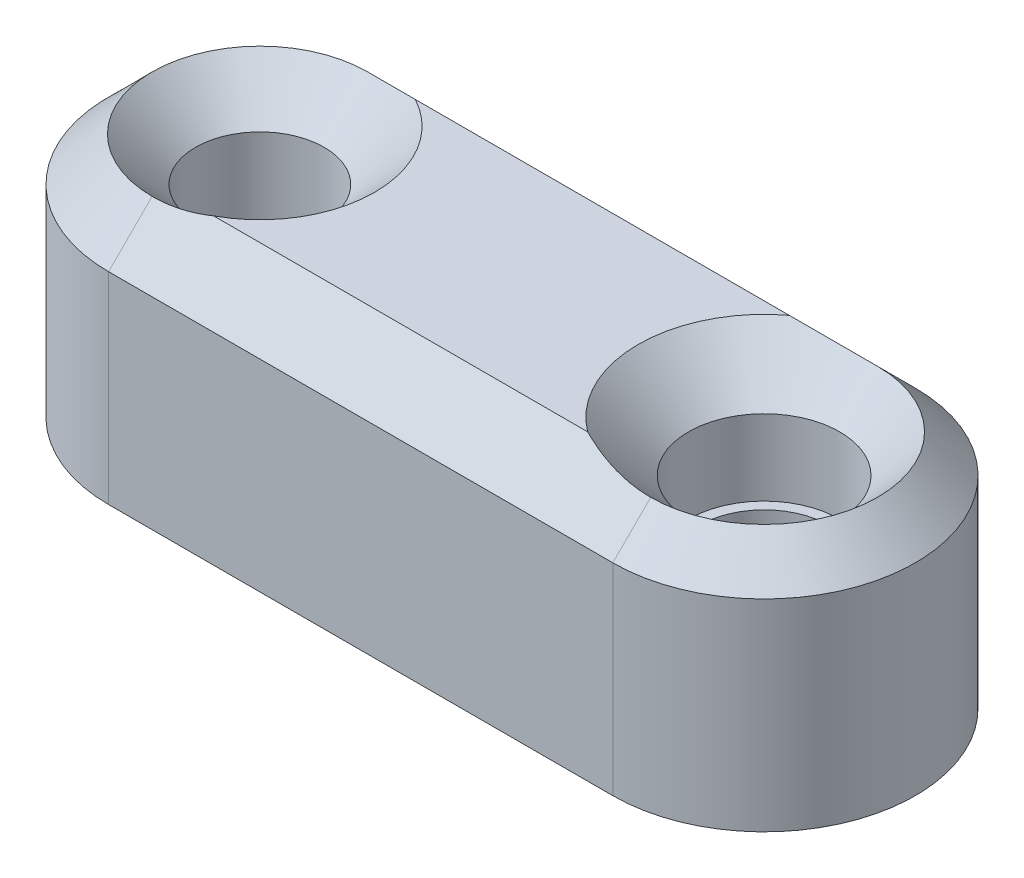
from build123d import *

# Parameters (mm, degrees)
EXTRUDE_1_DEPTH     = 10
CHAMFER_1_SIZE      = 2
CUT_EXTRUDE_1_DEPTH = 5


with BuildPart() as part:
    # 草图1 → 凸台-拉伸1 (new body)
    with BuildSketch(Plane(origin=(0, 0, 0), x_dir=(1, 0, 0), z_dir=(0, 1, 0))):
        with BuildLine():
            Line((0, 6), (20, 6))
            ThreePointArc((20, 6), (26, 0), (20, -6))
            Line((20, -6), (0, -6))
            ThreePointArc((0, -6), (-6, 0), (0, 6))
        make_face()
    extrude(amount=EXTRUDE_1_DEPTH)

    # 草图2 → 切除-旋转1 (revolve, cut)
    with BuildSketch(Plane.XY, mode=Mode.PRIVATE) as cut_revolve_1_sk:
        Polygon((-2.55, 10), (-2.55, 5), (-1.6, 5), (-1.6, 2), (-2.55, 2), (-2.55, 0), (0, 0), (0, 10), align=None)
    revolve(cut_revolve_1_sk.sketch.rotate(Axis((0, 0, 0), (0, 1, 0)), 270), axis=Axis((0, 0, 0), (0, 1, 0)), mode=Mode.SUBTRACT)

    # 草图3 → 切除-旋转2 (revolve, cut)
    with BuildSketch(Plane.XY, mode=Mode.PRIVATE) as cut_revolve_2_sk:
        Polygon((20, 0), (17.425, 0), (17.425, 5), (17, 5), (17, 10), (20, 10), align=None)
    revolve(cut_revolve_2_sk.sketch.rotate(Axis((20, 10, 0), (0, -1, 0)), 270), axis=Axis((20, 10, 0), (0, -1, 0)), mode=Mode.SUBTRACT)

    # 倒角1
    # the kernel refuses this chamfer: 2 mm, written as the material it takes off along each edge
    with BuildSketch(Plane(origin=(20, 10, 0), x_dir=(0, 0, -1), z_dir=(-1, 0, 0))) as chamfer_1_piece_1:
        Polygon((6, CHAMFER_1_SIZE), (6 - CHAMFER_1_SIZE, 0), (6, 0), align=None)
    revolve(axis=Axis((20, 10, 0), (0, -1, 0)), revolution_arc=180, mode=Mode.SUBTRACT)
    with BuildSketch(Plane(origin=(0, 10, 0), x_dir=(0, 0, -1), z_dir=(1, 0, 0))) as chamfer_1_piece_2:
        Polygon((2.55 + CHAMFER_1_SIZE, 0), (2.55, -CHAMFER_1_SIZE), (2.55, 0), align=None)
    revolve(axis=Axis((0, 10, 0), (0, 1, 0)), mode=Mode.SUBTRACT)
    with BuildSketch(Plane(origin=(0, 10, -6), x_dir=(0, -0.9996219169112968, -0.027495876610586487), z_dir=(1, 0, 0)), Plane(origin=(20, 10, 6), x_dir=(0, -0.9996219169112968, 0.027495876610586487), z_dir=(-1, 0, 0))) as chamfer_1_piece_3:
        Polygon((CHAMFER_1_SIZE * 0.999621916911, -CHAMFER_1_SIZE * 0.0274958766106), (-CHAMFER_1_SIZE * 0.0274958766106, -CHAMFER_1_SIZE * 0.999621916911), (0, 0), align=None)
    extrude(amount=20, mode=Mode.SUBTRACT)
    with BuildSketch(Plane(origin=(20, 10, 0), x_dir=(0, 0, 1), z_dir=(1, 0, 0))) as chamfer_1_piece_4:
        Polygon((3 + CHAMFER_1_SIZE, 0), (3, CHAMFER_1_SIZE), (3, 0), align=None)
    revolve(axis=Axis((20, 10, 0), (0, -1, 0)), mode=Mode.SUBTRACT)
    with BuildSketch(Plane(origin=(0, 10, 0), x_dir=(0, 0, 1), z_dir=(1, 0, 0))) as chamfer_1_piece_5:
        Polygon((6 - CHAMFER_1_SIZE, 0), (6, CHAMFER_1_SIZE), (6, 0), align=None)
    revolve(axis=Axis((0, 10, 0), (0, -1, 0)), revolution_arc=180, mode=Mode.SUBTRACT)

    # 草图4 → 切除-拉伸1 (cut)
    with BuildSketch(Plane.XZ):
        Polygon((-2.107328483, -3.65), (2.107328483, -3.65), (4.214656965, 0), (2.107328483, 3.65), (-2.107328483, 3.65), (-4.214656965, 0), align=None)
    extrude(amount=-CUT_EXTRUDE_1_DEPTH, mode=Mode.SUBTRACT)


solid = part.part
